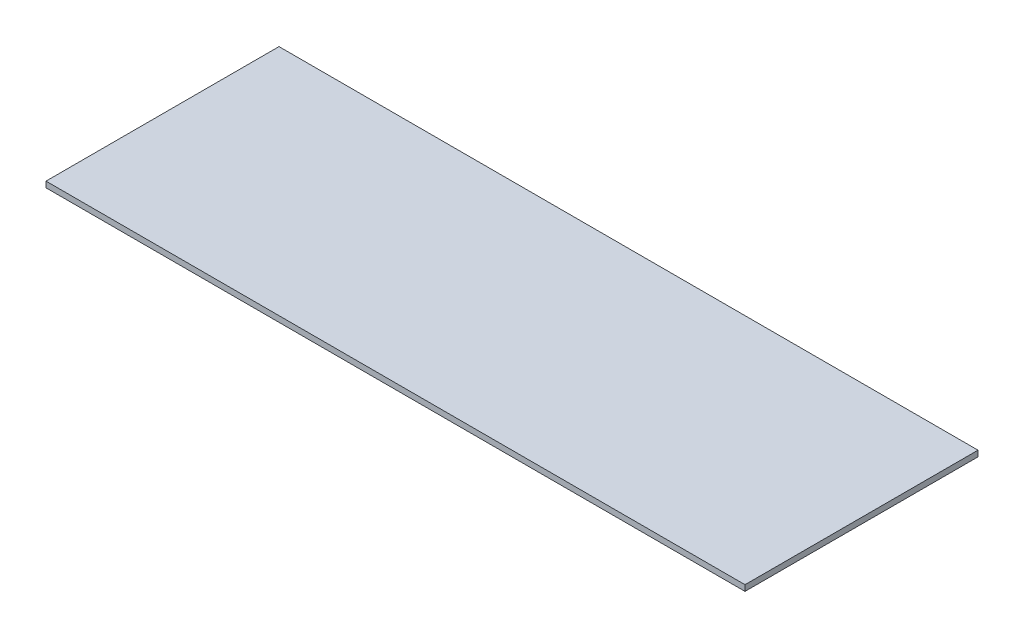
from build123d import *

# Parameters (mm, degrees)
SKETCH1_W           = 1200
SKETCH1_H           = 400
BOSS_EXTRUDE1_DEPTH = 10


with BuildPart() as part:
    # Sketch1 → Boss-Extrude1 (new body)
    with BuildSketch(Plane(origin=(0, 0, 0), x_dir=(1, 0, 0), z_dir=(0, 1, 0))):
        with Locations((526.797813746, 169.58500712)):
            Rectangle(SKETCH1_W, SKETCH1_H)
    extrude(amount=BOSS_EXTRUDE1_DEPTH)


solid = part.part
